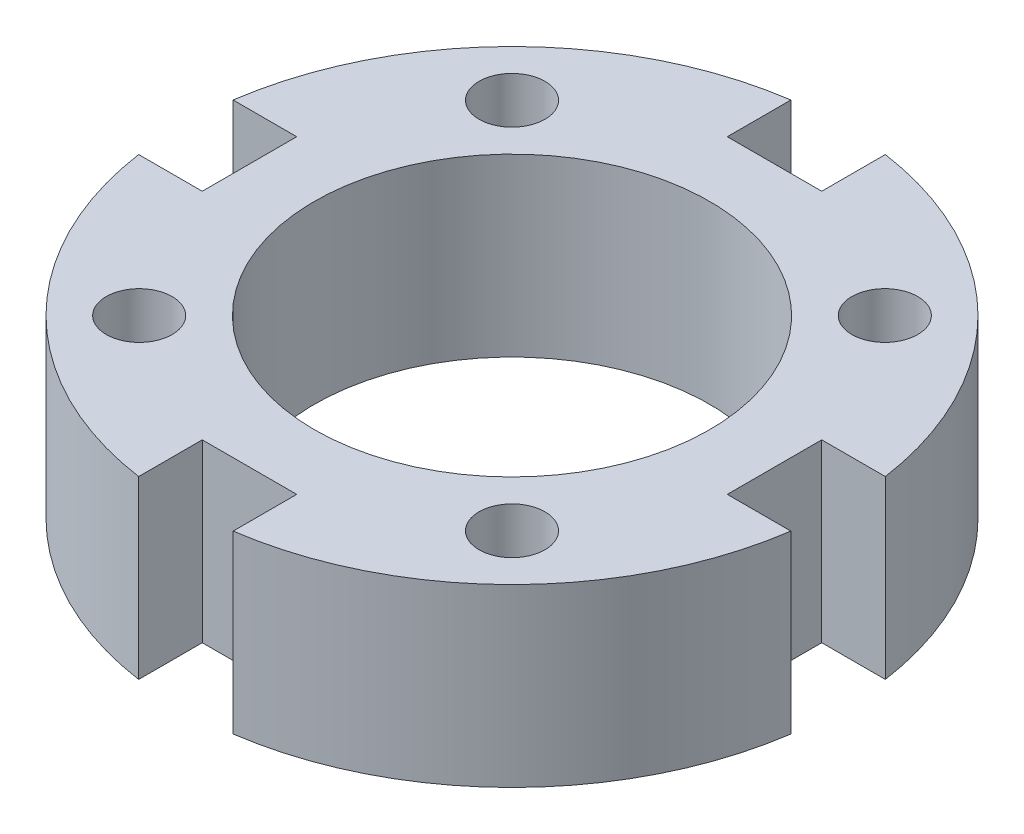
from build123d import *

# Parameters (mm, degrees)
SKETCH1_R           = 7.5
SKETCH1_R_2         = 4.5
BOSS_EXTRUDE1_DEPTH = 4
SKETCH3_W           = 1.525
SKETCH3_H           = 4
CUT_EXTRUDE1_DEPTH  = 1.075
CIRPATTERN1_COUNT   = 4
SKETCH6_R           = 0.75
CUT_EXTRUDE3_DEPTH  = 12.233376607
CIRPATTERN3_COUNT   = 4


with BuildPart() as part:
    # Sketch1 → Boss-Extrude1 (new body)
    with BuildSketch(Plane(origin=(0, 0, 0), x_dir=(1, 0, 0), z_dir=(0, 1, 0))):
        Circle(SKETCH1_R)
        Circle(SKETCH1_R_2, mode=Mode.SUBTRACT)
    extrude(amount=BOSS_EXTRUDE1_DEPTH)

    # Sketch3 → Cut-Extrude1 (cut, symmetric)
    with BuildSketch(Plane(origin=(0, 0, 0), x_dir=(0, 0, -1), z_dir=(1, 0, 0))):
        with Locations((-6.7375, 2)):
            Rectangle(SKETCH3_W, SKETCH3_H)
    cut_extrude1 = extrude(amount=CUT_EXTRUDE1_DEPTH, both=True, mode=Mode.SUBTRACT)

    # CirPattern1: Cut-Extrude1 ×4 about axis
    cirpattern1_axis = Axis((0, 0, 0), (0, 1, 0))
    for i in range(1, CIRPATTERN1_COUNT):
        add(cut_extrude1.rotate(cirpattern1_axis, i * 360 / CIRPATTERN1_COUNT), mode=Mode.SUBTRACT)

    # Sketch6 → Cut-Extrude3 (cut, through all)
    with BuildSketch(Plane.XZ):
        with Locations((4.242640687, 4.242640687)):
            Circle(SKETCH6_R)
    cut_extrude3 = extrude(amount=-CUT_EXTRUDE3_DEPTH, mode=Mode.SUBTRACT)

    # CirPattern3: Cut-Extrude3 ×4 about axis
    cirpattern3_axis = Axis((0, 0, 0), (0, 1, 0))
    for i in range(1, CIRPATTERN3_COUNT):
        add(cut_extrude3.rotate(cirpattern3_axis, i * 360 / CIRPATTERN3_COUNT), mode=Mode.SUBTRACT)


solid = part.part
